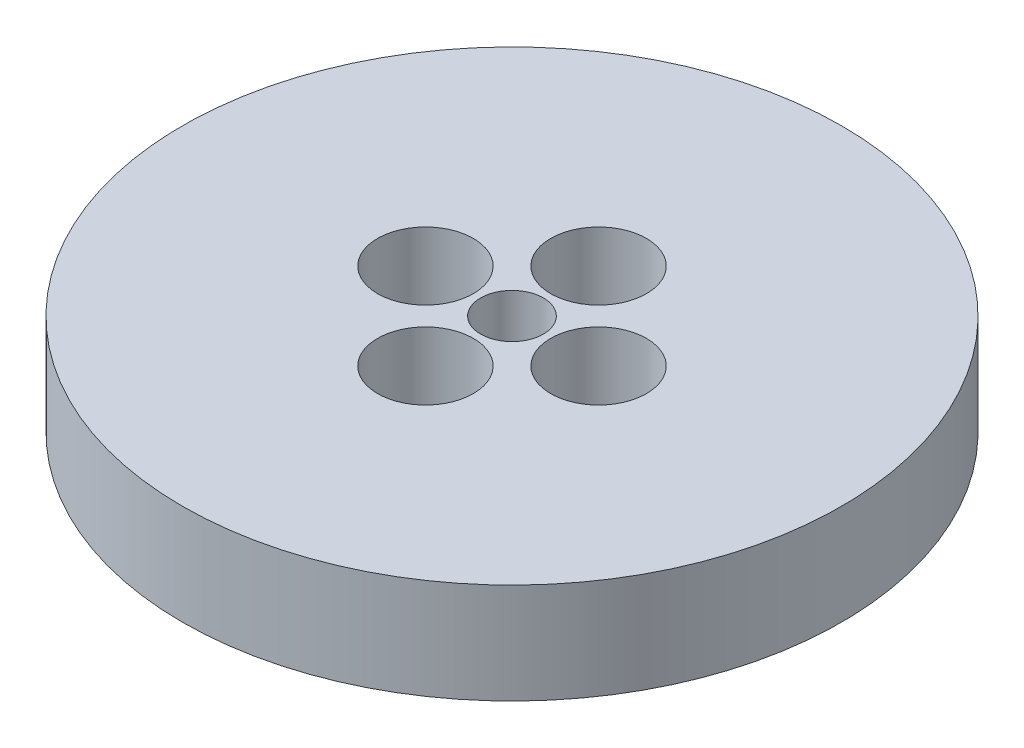
from build123d import *

# Parameters (mm, degrees)
SKETCH1_R           = 52.5
BOSS_EXTRUDE1_DEPTH = 16
SKETCH2_R           = 5
CUT_EXTRUDE1_DEPTH  = 76.950641867
SKETCH3_R           = 7.628906741
CUT_EXTRUDE2_DEPTH  = 15.236711819
CIRPATTERN1_COUNT   = 4


with BuildPart() as part:
    # Sketch1 → Boss-Extrude1 (new body)
    with BuildSketch(Plane(origin=(0, 0, 0), x_dir=(1, 0, 0), z_dir=(0, 1, 0))):
        Circle(SKETCH1_R)
    extrude(amount=BOSS_EXTRUDE1_DEPTH)

    # Sketch2 → Cut-Extrude1 (cut, through all)
    with BuildSketch(Plane(origin=(0, 0, 0), x_dir=(1, 0, 0), z_dir=(0, 1, 0))):
        Circle(SKETCH2_R)
    extrude(amount=CUT_EXTRUDE1_DEPTH, mode=Mode.SUBTRACT)

    # Sketch3 → Cut-Extrude2 (cut)
    with BuildSketch(Plane(origin=(0, 16, 0), x_dir=(1, 0, 0), z_dir=(0, 1, 0))):
        with Locations((-13.78860733, 0)):
            Circle(SKETCH3_R)
    cut_extrude2 = extrude(amount=-CUT_EXTRUDE2_DEPTH, mode=Mode.SUBTRACT)

    # CirPattern1: Cut-Extrude2 ×4 about axis
    cirpattern1_axis = Axis((0, 0, 0), (0, 1, 0))
    for i in range(1, CIRPATTERN1_COUNT):
        add(cut_extrude2.rotate(cirpattern1_axis, i * 360 / CIRPATTERN1_COUNT), mode=Mode.SUBTRACT)


solid = part.part
